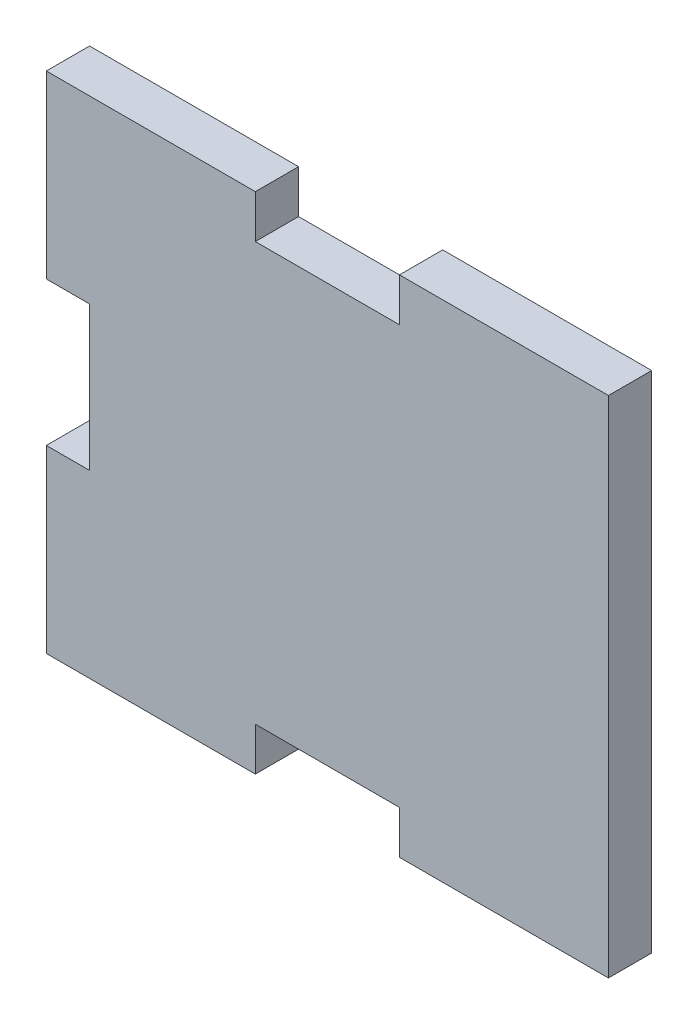
from build123d import *

# Parameters (mm, degrees)
RESSALTO_EXTRUS_O1_DEPTH = 3


with BuildPart() as part:
    # Esboço1 → Ressalto-extrusão1 (new body)
    with BuildSketch(Plane.XY):
        Polygon((-19.5, -5), (-19.5, -17.5), (-5, -17.5), (-5, -14.5), (5, -14.5), (5, -17.5), (19.5, -17.5), (19.5, 17.5), (5, 17.5), (5, 14.5), (-5, 14.5), (-5, 17.5), (-19.5, 17.5), (-19.5, 5), (-16.5, 5), (-16.5, -5), align=None)
    extrude(amount=RESSALTO_EXTRUS_O1_DEPTH)


solid = part.part
